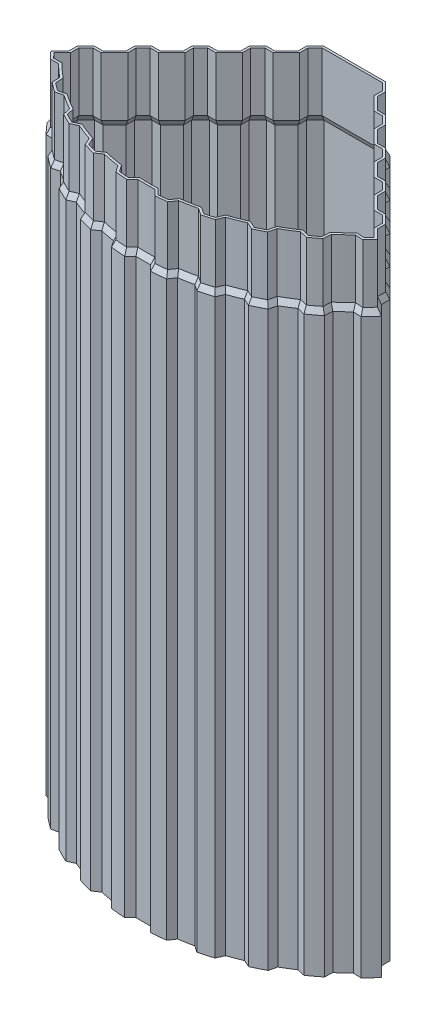
from build123d import *

# Parameters (mm, degrees)
EXTRUDE_THIN2_DEPTH = 195
EXTRUDE_THIN3_DEPTH = 20


# Read off the part's stored shape, not the designer's step: Extrude-Thin2
with BuildPart() as part:
    # Extrude-Thin2 outline → Extrude-Thin2 (new body)
    with BuildSketch(Plane(origin=(0, 0, 0), x_dir=(1, 0, 0), z_dir=(0, 1, 0))):
        with BuildLine():
            Line((11, 0), (-11, 0))
            Line((-11, 0), (-14.464746304, -3.464746304))
            Line((-14.464746304, -3.464746304), (-14.464746304, -6.293173428))
            Line((-14.464746304, -6.293173428), (-17.929492607, -9.757919732))
            Line((-17.929492607, -9.757919732), (-20.757919732, -9.757919732))
            Line((-20.757919732, -9.757919732), (-24.222666036, -13.222666036))
            Line((-24.222666036, -13.222666036), (-24.222666036, -16.05109316))
            Line((-24.222666036, -16.05109316), (-27.687412339, -19.515839464))
            Line((-27.687412339, -19.515839464), (-30.515839464, -19.515839464))
            Line((-30.515839464, -19.515839464), (-33.980585767, -22.980585767))
            Line((-33.980585767, -22.980585767), (-33.980585767, -25.809012892))
            Line((-33.980585767, -25.809012892), (-37.445332071, -29.273759196))
            Line((-37.445332071, -29.273759196), (-40.273759196, -29.273759196))
            Line((-40.273759196, -29.273759196), (-43.738505499, -32.738505499))
            Line((-43.738505499, -32.738505499), (-43.738505499, -35.566932624))
            Line((-43.738505499, -35.566932624), (-47.203251803, -39.031678928))
            Line((-47.203251803, -39.031678928), (-50.031678928, -39.031678928))
            Line((-50.031678928, -39.031678928), (-53.496425231, -42.496425231))
            Line((-53.496425231, -42.496425231), (-53.496425231, -45.324852356))
            Line((-53.496425231, -45.324852356), (-56.961171535, -48.78959866))
            ThreePointArc((-56.961171535, -48.78959866), (-55.321694232, -50.640992756), (-53.622070731, -52.437329552))
            Line((-53.622070731, -52.437329552), (-50.919920763, -52.308332697))
            ThreePointArc((-50.919920763, -52.308332697), (-49.098670593, -54.021482264), (-47.219819238, -55.67125534))
            Line((-47.219819238, -55.67125534), (-47.090822383, -58.373405308))
            ThreePointArc((-47.090822383, -58.373405308), (-45.118873367, -59.910660705), (-43.096778336, -61.381330199))
            Line((-43.096778336, -61.381330199), (-40.464106768, -60.758999855))
            ThreePointArc((-40.464106768, -60.758999855), (-38.359583424, -62.109116558), (-36.210057689, -63.386368583))
            Line((-36.210057689, -63.386368583), (-35.587727345, -66.019040151))
            ThreePointArc((-35.587727345, -66.019040151), (-33.367316218, -67.16861029), (-31.109819992, -68.243527899))
            Line((-31.109819992, -68.243527899), (-28.635916247, -67.148970958))
            ThreePointArc((-28.635916247, -67.148970958), (-26.319496526, -68.090264375), (-23.972199509, -68.951676199))
            Line((-23.972199509, -68.951676199), (-22.877642568, -71.425579945))
            ThreePointArc((-22.877642568, -71.425579945), (-20.48407657, -72.148476125), (-18.06774416, -72.79118505))
            Line((-18.06774416, -72.79118505), (-15.836512903, -71.261524395))
            ThreePointArc((-15.836512903, -71.261524395), (-13.386760262, -71.762069714), (-10.921302649, -72.178425783))
            Line((-10.921302649, -72.178425783), (-9.391641994, -74.409657039))
            ThreePointArc((-9.391641994, -74.409657039), (-6.906101064, -74.681361584), (-4.412884555, -74.870063777))
            Line((-4.412884555, -74.870063777), (-2.5, -72.957179222))
            ThreePointArc((-2.5, -72.957179222), (0, -73), (2.5, -72.957179222))
            Line((2.5, -72.957179222), (4.412884555, -74.870063777))
            ThreePointArc((4.412884555, -74.870063777), (6.906101064, -74.681361584), (9.391641994, -74.409657039))
            Line((9.391641994, -74.409657039), (10.921302649, -72.178425783))
            ThreePointArc((10.921302649, -72.178425783), (13.386760262, -71.762069714), (15.836512903, -71.261524395))
            Line((15.836512903, -71.261524395), (18.06774416, -72.79118505))
            ThreePointArc((18.06774416, -72.79118505), (20.48407657, -72.148476125), (22.877642568, -71.425579945))
            Line((22.877642568, -71.425579945), (23.972199509, -68.951676199))
            ThreePointArc((23.972199509, -68.951676199), (26.319496526, -68.090264375), (28.635916247, -67.148970958))
            Line((28.635916247, -67.148970958), (31.109819992, -68.243527899))
            ThreePointArc((31.109819992, -68.243527899), (33.367316218, -67.16861029), (35.587727345, -66.019040151))
            Line((35.587727345, -66.019040151), (36.210057689, -63.386368583))
            ThreePointArc((36.210057689, -63.386368583), (38.359583424, -62.109116558), (40.464106768, -60.758999855))
            Line((40.464106768, -60.758999855), (43.096778336, -61.381330199))
            ThreePointArc((43.096778336, -61.381330199), (45.118873367, -59.910660705), (47.090822383, -58.373405308))
            Line((47.090822383, -58.373405308), (47.219819238, -55.67125534))
            ThreePointArc((47.219819238, -55.67125534), (49.098670593, -54.021482264), (50.919920763, -52.308332697))
            Line((50.919920763, -52.308332697), (53.622070731, -52.437329552))
            ThreePointArc((53.622070731, -52.437329552), (55.321694232, -50.640992756), (56.961171535, -48.78959866))
            Line((56.961171535, -48.78959866), (53.496425231, -45.324852356))
            Line((53.496425231, -45.324852356), (53.496425231, -42.496425231))
            Line((53.496425231, -42.496425231), (50.031678928, -39.031678928))
            Line((50.031678928, -39.031678928), (47.203251803, -39.031678928))
            Line((47.203251803, -39.031678928), (43.738505499, -35.566932624))
            Line((43.738505499, -35.566932624), (43.738505499, -32.738505499))
            Line((43.738505499, -32.738505499), (40.273759196, -29.273759196))
            Line((40.273759196, -29.273759196), (37.445332071, -29.273759196))
            Line((37.445332071, -29.273759196), (33.980585767, -25.809012892))
            Line((33.980585767, -25.809012892), (33.980585767, -22.980585767))
            Line((33.980585767, -22.980585767), (30.515839464, -19.515839464))
            Line((30.515839464, -19.515839464), (27.687412339, -19.515839464))
            Line((27.687412339, -19.515839464), (24.222666036, -16.05109316))
            Line((24.222666036, -16.05109316), (24.222666036, -13.222666036))
            Line((24.222666036, -13.222666036), (20.757919732, -9.757919732))
            Line((20.757919732, -9.757919732), (17.929492607, -9.757919732))
            Line((17.929492607, -9.757919732), (14.464746304, -6.293173428))
            Line((14.464746304, -6.293173428), (14.464746304, -3.464746304))
            Line((14.464746304, -3.464746304), (11, 0))
        make_face()
        with BuildLine():
            Line((-13.664746304, -3.796117153), (-10.66862915, -0.8))
            Line((-10.66862915, -0.8), (10.66862915, -0.8))
            Line((10.66862915, -0.8), (13.664746304, -3.796117153))
            Line((13.664746304, -3.796117153), (13.664746304, -6.624544278))
            Line((13.664746304, -6.624544278), (17.598121757, -10.557919732))
            Line((17.598121757, -10.557919732), (20.426548882, -10.557919732))
            Line((20.426548882, -10.557919732), (23.422666036, -13.554036885))
            Line((23.422666036, -13.554036885), (23.422666036, -16.38246401))
            Line((23.422666036, -16.38246401), (27.356041489, -20.315839464))
            Line((27.356041489, -20.315839464), (30.184468614, -20.315839464))
            Line((30.184468614, -20.315839464), (33.180585767, -23.311956617))
            Line((33.180585767, -23.311956617), (33.180585767, -26.140383742))
            Line((33.180585767, -26.140383742), (37.113961221, -30.073759196))
            Line((37.113961221, -30.073759196), (39.942388346, -30.073759196))
            Line((39.942388346, -30.073759196), (42.938505499, -33.069876349))
            Line((42.938505499, -33.069876349), (42.938505499, -35.898303474))
            Line((42.938505499, -35.898303474), (46.871880953, -39.831678928))
            Line((46.871880953, -39.831678928), (49.700308078, -39.831678928))
            Line((49.700308078, -39.831678928), (52.696425231, -42.827796081))
            Line((52.696425231, -42.827796081), (52.696425231, -45.656223206))
            Line((52.696425231, -45.656223206), (55.869206916, -48.82900489))
            ThreePointArc((55.869206916, -48.82900489), (54.602532645, -50.2414513), (53.300160418, -51.621050933))
            Line((53.300160418, -51.621050933), (50.609786331, -51.492616242))
            ThreePointArc((50.609786331, -51.492616242), (48.56060297, -53.42946602), (46.437355761, -55.284826037))
            Line((46.437355761, -55.284826037), (46.30892107, -57.975200123))
            ThreePointArc((46.30892107, -57.975200123), (44.637605384, -59.271613657), (42.930016361, -60.51986199))
            Line((42.930016361, -60.51986199), (40.308817891, -59.900243741))
            ThreePointArc((40.308817891, -59.900243741), (37.939204427, -61.428468705), (35.511726701, -62.863003959))
            Line((35.511726701, -62.863003959), (34.892108452, -65.484202429))
            ThreePointArc((34.892108452, -65.484202429), (33.011398179, -66.452145114), (31.103862238, -67.366087566))
            Line((31.103862238, -67.366087566), (28.640739684, -66.276300669))
            ThreePointArc((28.640739684, -66.276300669), (26.031063687, -67.344069697), (23.381685532, -68.309126635))
            Line((23.381685532, -68.309126635), (22.291898635, -70.772249189))
            ThreePointArc((22.291898635, -70.772249189), (20.265579753, -71.378892379), (18.222792688, -71.927531771))
            Line((18.222792688, -71.927531771), (16.001285065, -70.404537327))
            ThreePointArc((16.001285065, -70.404537327), (13.24005604, -70.975636074), (10.458633495, -71.438483924))
            Line((10.458633495, -71.438483924), (8.935639052, -73.659991547))
            ThreePointArc((8.935639052, -73.659991547), (6.832435985, -73.884760394), (4.723680756, -74.049489128))
            Line((4.723680756, -74.049489128), (2.81913249, -72.144940862))
            ThreePointArc((2.81913249, -72.144940862), (0, -72.2), (-2.81913249, -72.144940862))
            Line((-2.81913249, -72.144940862), (-4.723680756, -74.049489128))
            ThreePointArc((-4.723680756, -74.049489128), (-6.832435985, -73.884760394), (-8.935639052, -73.659991547))
            Line((-8.935639052, -73.659991547), (-10.458633495, -71.438483924))
            ThreePointArc((-10.458633495, -71.438483924), (-13.24005604, -70.975636074), (-16.001285065, -70.404537327))
            Line((-16.001285065, -70.404537327), (-18.222792688, -71.927531771))
            ThreePointArc((-18.222792688, -71.927531771), (-20.265579753, -71.378892379), (-22.291898635, -70.772249189))
            Line((-22.291898635, -70.772249189), (-23.381685532, -68.309126635))
            ThreePointArc((-23.381685532, -68.309126635), (-26.031063687, -67.344069697), (-28.640739684, -66.276300669))
            Line((-28.640739684, -66.276300669), (-31.103862238, -67.366087566))
            ThreePointArc((-31.103862238, -67.366087566), (-33.011398179, -66.452145114), (-34.892108452, -65.484202429))
            Line((-34.892108452, -65.484202429), (-35.511726701, -62.863003959))
            ThreePointArc((-35.511726701, -62.863003959), (-37.939204427, -61.428468705), (-40.308817891, -59.900243741))
            Line((-40.308817891, -59.900243741), (-42.930016361, -60.51986199))
            ThreePointArc((-42.930016361, -60.51986199), (-44.637605384, -59.271613657), (-46.30892107, -57.975200123))
            Line((-46.30892107, -57.975200123), (-46.437355761, -55.284826037))
            ThreePointArc((-46.437355761, -55.284826037), (-48.56060297, -53.42946602), (-50.609786331, -51.492616242))
            Line((-50.609786331, -51.492616242), (-53.300160418, -51.621050933))
            ThreePointArc((-53.300160418, -51.621050933), (-54.602532645, -50.2414513), (-55.869206916, -48.82900489))
            Line((-55.869206916, -48.82900489), (-52.696425231, -45.656223206))
            Line((-52.696425231, -45.656223206), (-52.696425231, -42.827796081))
            Line((-52.696425231, -42.827796081), (-49.700308078, -39.831678928))
            Line((-49.700308078, -39.831678928), (-46.871880953, -39.831678928))
            Line((-46.871880953, -39.831678928), (-42.938505499, -35.898303474))
            Line((-42.938505499, -35.898303474), (-42.938505499, -33.069876349))
            Line((-42.938505499, -33.069876349), (-39.942388346, -30.073759196))
            Line((-39.942388346, -30.073759196), (-37.113961221, -30.073759196))
            Line((-37.113961221, -30.073759196), (-33.180585767, -26.140383742))
            Line((-33.180585767, -26.140383742), (-33.180585767, -23.311956617))
            Line((-33.180585767, -23.311956617), (-30.184468614, -20.315839464))
            Line((-30.184468614, -20.315839464), (-27.356041489, -20.315839464))
            Line((-27.356041489, -20.315839464), (-23.422666036, -16.38246401))
            Line((-23.422666036, -16.38246401), (-23.422666036, -13.554036885))
            Line((-23.422666036, -13.554036885), (-20.426548882, -10.557919732))
            Line((-20.426548882, -10.557919732), (-17.598121757, -10.557919732))
            Line((-17.598121757, -10.557919732), (-13.664746304, -6.624544278))
            Line((-13.664746304, -6.624544278), (-13.664746304, -3.796117153))
        make_face(mode=Mode.SUBTRACT)
    extrude(amount=EXTRUDE_THIN2_DEPTH)



with BuildPart() as body_2:
    # Sketch7 → Extrude-Thin3 (new body)
    with BuildSketch(Plane(origin=(0, 197, 0), x_dir=(1, 0, 0), z_dir=(0, 1, 0))):
        with BuildLine():
            Line((55.595386981, -48.838027668), (52.496425231, -45.739065918))
            Line((52.496425231, -45.739065918), (52.496425231, -42.910638794))
            Line((52.496425231, -42.910638794), (49.617465365, -40.031678928))
            Line((49.617465365, -40.031678928), (46.789038241, -40.031678928))
            Line((46.789038241, -40.031678928), (42.738505499, -35.981146187))
            Line((42.738505499, -35.981146187), (42.738505499, -33.152719062))
            Line((42.738505499, -33.152719062), (39.859545633, -30.273759196))
            Line((39.859545633, -30.273759196), (37.031118509, -30.273759196))
            Line((37.031118509, -30.273759196), (32.980585767, -26.223226455))
            Line((32.980585767, -26.223226455), (32.980585767, -23.39479933))
            Line((32.980585767, -23.39479933), (30.101625901, -20.515839464))
            Line((30.101625901, -20.515839464), (27.273198777, -20.515839464))
            Line((27.273198777, -20.515839464), (23.222666036, -16.465306723))
            Line((23.222666036, -16.465306723), (23.222666036, -13.636879598))
            Line((23.222666036, -13.636879598), (20.34370617, -10.757919732))
            Line((20.34370617, -10.757919732), (17.515279045, -10.757919732))
            Line((17.515279045, -10.757919732), (13.464746304, -6.707386991))
            Line((13.464746304, -6.707386991), (13.464746304, -3.878959866))
            Line((13.464746304, -3.878959866), (10.585786438, -1))
            Line((10.585786438, -1), (-10.585786438, -1))
            Line((-10.585786438, -1), (-13.464746304, -3.878959866))
            Line((-13.464746304, -3.878959866), (-13.464746304, -6.707386991))
            Line((-13.464746304, -6.707386991), (-17.515279045, -10.757919732))
            Line((-17.515279045, -10.757919732), (-20.34370617, -10.757919732))
            Line((-20.34370617, -10.757919732), (-23.222666036, -13.636879598))
            Line((-23.222666036, -13.636879598), (-23.222666036, -16.465306723))
            Line((-23.222666036, -16.465306723), (-27.273198777, -20.515839464))
            Line((-27.273198777, -20.515839464), (-30.101625901, -20.515839464))
            Line((-30.101625901, -20.515839464), (-32.980585767, -23.39479933))
            Line((-32.980585767, -23.39479933), (-32.980585767, -26.223226455))
            Line((-32.980585767, -26.223226455), (-37.031118509, -30.273759196))
            Line((-37.031118509, -30.273759196), (-39.859545633, -30.273759196))
            Line((-39.859545633, -30.273759196), (-42.738505499, -33.152719062))
            Line((-42.738505499, -33.152719062), (-42.738505499, -35.981146187))
            Line((-42.738505499, -35.981146187), (-46.789038241, -40.031678928))
            Line((-46.789038241, -40.031678928), (-49.617465365, -40.031678928))
            Line((-49.617465365, -40.031678928), (-52.496425231, -42.910638794))
            Line((-52.496425231, -42.910638794), (-52.496425231, -45.739065918))
            Line((-52.496425231, -45.739065918), (-55.595386981, -48.838027668))
            ThreePointArc((-55.595386981, -48.838027668), (-54.422630791, -50.141572151), (-53.219318169, -51.41696387))
            Line((-53.219318169, -51.41696387), (-50.53189417, -51.288670012))
            ThreePointArc((-50.53189417, -51.288670012), (-48.426086065, -53.281461959), (-46.241757009, -55.187860158))
            Line((-46.241757009, -55.187860158), (-46.113463151, -57.875284157))
            ThreePointArc((-46.113463151, -57.875284157), (-44.517288389, -59.111851895), (-42.887970574, -60.30441095))
            Line((-42.887970574, -60.30441095), (-40.269646337, -59.685472134))
            ThreePointArc((-40.269646337, -59.685472134), (-37.834109678, -61.258306742), (-35.337226532, -62.731813468))
            Line((-35.337226532, -62.731813468), (-34.718287716, -65.350137705))
            ThreePointArc((-34.718287716, -65.350137705), (-32.922418669, -66.27302882), (-31.102038932, -67.146579766))
            Line((-31.102038932, -67.146579766), (-28.641617276, -66.057987858))
            ThreePointArc((-28.641617276, -66.057987858), (-25.958955478, -67.157521027), (-23.234202276, -68.148160977))
            Line((-23.234202276, -68.148160977), (-22.145610368, -70.608582633))
            ThreePointArc((-22.145610368, -70.608582633), (-20.210955548, -71.186496443), (-18.261253703, -71.711412015))
            Line((-18.261253703, -71.711412015), (-16.042182039, -70.190087587))
            ThreePointArc((-16.042182039, -70.190087587), (-13.203379985, -70.779027663), (-10.343169181, -71.253202393))
            Line((-10.343169181, -71.253202393), (-8.821844752, -73.472274057))
            ThreePointArc((-8.821844752, -73.472274057), (-6.814019716, -73.685610097), (-4.801121652, -73.844087312))
            Line((-4.801121652, -73.844087312), (-2.898661788, -71.941627448))
            ThreePointArc((-2.898661788, -71.941627448), (0, -72), (2.898661788, -71.941627448))
            Line((2.898661788, -71.941627448), (4.801121652, -73.844087312))
            ThreePointArc((4.801121652, -73.844087312), (6.814019716, -73.685610097), (8.821844752, -73.472274057))
            Line((8.821844752, -73.472274057), (10.343169181, -71.253202393))
            ThreePointArc((10.343169181, -71.253202393), (13.203379985, -70.779027663), (16.042182039, -70.190087587))
            Line((16.042182039, -70.190087587), (18.261253703, -71.711412015))
            ThreePointArc((18.261253703, -71.711412015), (20.210955548, -71.186496443), (22.145610368, -70.608582633))
            Line((22.145610368, -70.608582633), (23.234202276, -68.148160977))
            ThreePointArc((23.234202276, -68.148160977), (25.958955478, -67.157521027), (28.641617276, -66.057987858))
            Line((28.641617276, -66.057987858), (31.102038932, -67.146579766))
            ThreePointArc((31.102038932, -67.146579766), (32.922418669, -66.27302882), (34.718287716, -65.350137705))
            Line((34.718287716, -65.350137705), (35.337226532, -62.731813468))
            ThreePointArc((35.337226532, -62.731813468), (37.834109678, -61.258306742), (40.269646337, -59.685472134))
            Line((40.269646337, -59.685472134), (42.887970574, -60.30441095))
            ThreePointArc((42.887970574, -60.30441095), (44.517288389, -59.111851895), (46.113463151, -57.875284157))
            Line((46.113463151, -57.875284157), (46.241757009, -55.187860158))
            ThreePointArc((46.241757009, -55.187860158), (48.426086065, -53.281461959), (50.53189417, -51.288670012))
            Line((50.53189417, -51.288670012), (53.219318169, -51.41696387))
            ThreePointArc((53.219318169, -51.41696387), (54.422630791, -50.141572151), (55.595386981, -48.838027668))
        make_face()
        with BuildLine():
            Line((54.496715687, -48.870727224), (51.696425231, -46.070436768))
            Line((51.696425231, -46.070436768), (51.696425231, -43.242009644))
            Line((51.696425231, -43.242009644), (49.286094515, -40.831678928))
            Line((49.286094515, -40.831678928), (46.457667391, -40.831678928))
            Line((46.457667391, -40.831678928), (41.938505499, -36.312517036))
            Line((41.938505499, -36.312517036), (41.938505499, -33.484089912))
            Line((41.938505499, -33.484089912), (39.528174784, -31.073759196))
            Line((39.528174784, -31.073759196), (36.699747659, -31.073759196))
            Line((36.699747659, -31.073759196), (32.180585767, -26.554597304))
            Line((32.180585767, -26.554597304), (32.180585767, -23.72617018))
            Line((32.180585767, -23.72617018), (29.770255052, -21.315839464))
            Line((29.770255052, -21.315839464), (26.941827927, -21.315839464))
            Line((26.941827927, -21.315839464), (22.422666036, -16.796677573))
            Line((22.422666036, -16.796677573), (22.422666036, -13.968250448))
            Line((22.422666036, -13.968250448), (20.01233532, -11.557919732))
            Line((20.01233532, -11.557919732), (17.183908195, -11.557919732))
            Line((17.183908195, -11.557919732), (12.664746304, -7.038757841))
            Line((12.664746304, -7.038757841), (12.664746304, -4.210330716))
            Line((12.664746304, -4.210330716), (10.254415588, -1.8))
            Line((10.254415588, -1.8), (-10.254415588, -1.8))
            Line((-10.254415588, -1.8), (-12.664746304, -4.210330716))
            Line((-12.664746304, -4.210330716), (-12.664746304, -7.038757841))
            Line((-12.664746304, -7.038757841), (-17.183908195, -11.557919732))
            Line((-17.183908195, -11.557919732), (-20.01233532, -11.557919732))
            Line((-20.01233532, -11.557919732), (-22.422666036, -13.968250448))
            Line((-22.422666036, -13.968250448), (-22.422666036, -16.796677573))
            Line((-22.422666036, -16.796677573), (-26.941827927, -21.315839464))
            Line((-26.941827927, -21.315839464), (-29.770255052, -21.315839464))
            Line((-29.770255052, -21.315839464), (-32.180585767, -23.72617018))
            Line((-32.180585767, -23.72617018), (-32.180585767, -26.554597304))
            Line((-32.180585767, -26.554597304), (-36.699747659, -31.073759196))
            Line((-36.699747659, -31.073759196), (-39.528174784, -31.073759196))
            Line((-39.528174784, -31.073759196), (-41.938505499, -33.484089912))
            Line((-41.938505499, -33.484089912), (-41.938505499, -36.312517036))
            Line((-41.938505499, -36.312517036), (-46.457667391, -40.831678928))
            Line((-46.457667391, -40.831678928), (-49.286094515, -40.831678928))
            Line((-49.286094515, -40.831678928), (-51.696425231, -43.242009644))
            Line((-51.696425231, -43.242009644), (-51.696425231, -46.070436768))
            Line((-51.696425231, -46.070436768), (-54.496715687, -48.870727224))
            ThreePointArc((-54.496715687, -48.870727224), (-53.702557706, -49.742087771), (-52.894468995, -50.600544955))
            Line((-52.894468995, -50.600544955), (-50.218869817, -50.472815597))
            ThreePointArc((-50.218869817, -50.472815597), (-47.888018442, -52.689445715), (-45.459431492, -54.798540933))
            Line((-45.459431492, -54.798540933), (-45.331702135, -57.474140112))
            ThreePointArc((-45.331702135, -57.474140112), (-44.036020406, -58.472804848), (-42.718345303, -59.442265894))
            Line((-42.718345303, -59.442265894), (-40.111541844, -58.826050444))
            ThreePointArc((-40.111541844, -58.826050444), (-37.413730682, -60.577658889), (-34.639561119, -62.205633229))
            Line((-34.639561119, -62.205633229), (-34.02334567, -64.812436688))
            ThreePointArc((-34.02334567, -64.812436688), (-32.56650063, -65.556563643), (-31.093390558, -66.267948992))
            Line((-31.093390558, -66.267948992), (-28.6437949, -65.184146951))
            ThreePointArc((-28.6437949, -65.184146951), (-25.670522639, -66.411326349), (-22.644858917, -67.502965599))
            Line((-22.644858917, -67.502965599), (-21.561056876, -69.952561257))
            ThreePointArc((-21.561056876, -69.952561257), (-19.992458732, -70.416912698), (-18.413875543, -70.846095076))
            Line((-18.413875543, -70.846095076), (-16.204567922, -69.331464563))
            ThreePointArc((-16.204567922, -69.331464563), (-13.056675763, -69.992594023), (-9.882135983, -70.510874256))
            Line((-9.882135983, -70.510874256), (-8.36750547, -72.720181877))
            ThreePointArc((-8.36750547, -72.720181877), (-6.740354638, -72.889008906), (-5.109837399, -73.021432208))
            Line((-5.109837399, -73.021432208), (-3.215748468, -71.127343278))
            ThreePointArc((-3.215748468, -71.127343278), (0, -71.2), (3.215748468, -71.127343278))
            Line((3.215748468, -71.127343278), (5.109837399, -73.021432208))
            ThreePointArc((5.109837399, -73.021432208), (6.740354638, -72.889008906), (8.36750547, -72.720181877))
            Line((8.36750547, -72.720181877), (9.882135983, -70.510874256))
            ThreePointArc((9.882135983, -70.510874256), (13.056675763, -69.992594023), (16.204567922, -69.331464563))
            Line((16.204567922, -69.331464563), (18.413875543, -70.846095076))
            ThreePointArc((18.413875543, -70.846095076), (19.992458732, -70.416912698), (21.561056876, -69.952561257))
            Line((21.561056876, -69.952561257), (22.644858917, -67.502965599))
            ThreePointArc((22.644858917, -67.502965599), (25.670522639, -66.411326349), (28.6437949, -65.184146951))
            Line((28.6437949, -65.184146951), (31.093390558, -66.267948992))
            ThreePointArc((31.093390558, -66.267948992), (32.56650063, -65.556563643), (34.02334567, -64.812436688))
            Line((34.02334567, -64.812436688), (34.639561119, -62.205633229))
            ThreePointArc((34.639561119, -62.205633229), (37.413730682, -60.577658889), (40.111541844, -58.826050444))
            Line((40.111541844, -58.826050444), (42.718345303, -59.442265894))
            ThreePointArc((42.718345303, -59.442265894), (44.036020406, -58.472804848), (45.331702135, -57.474140112))
            Line((45.331702135, -57.474140112), (45.459431492, -54.798540933))
            ThreePointArc((45.459431492, -54.798540933), (47.888018442, -52.689445715), (50.218869817, -50.472815597))
            Line((50.218869817, -50.472815597), (52.894468995, -50.600544955))
            ThreePointArc((52.894468995, -50.600544955), (53.702557706, -49.742087771), (54.496715687, -48.870727224))
        make_face(mode=Mode.SUBTRACT)
    extrude(amount=EXTRUDE_THIN3_DEPTH)


with BuildPart() as part_1:
    add(part.part)

    add(body_2.part)  # Loft1 merges body 2
    # Sketch9 → Loft1 section 0
    with BuildSketch(Plane(origin=(0, 195, 0), x_dir=(1, 0, 0), z_dir=(0, 1, 0))):
        with BuildLine():
            Line((14.464746304, -3.464746304), (11, 0))
            Line((11, 0), (-11, 0))
            Line((-11, 0), (-14.464746304, -3.464746304))
            Line((-14.464746304, -3.464746304), (-14.464746304, -6.293173428))
            Line((-14.464746304, -6.293173428), (-17.929492607, -9.757919732))
            Line((-17.929492607, -9.757919732), (-20.757919732, -9.757919732))
            Line((-20.757919732, -9.757919732), (-24.222666036, -13.222666036))
            Line((-24.222666036, -13.222666036), (-24.222666036, -16.05109316))
            Line((-24.222666036, -16.05109316), (-27.687412339, -19.515839464))
            Line((-27.687412339, -19.515839464), (-30.515839464, -19.515839464))
            Line((-30.515839464, -19.515839464), (-33.980585767, -22.980585767))
            Line((-33.980585767, -22.980585767), (-33.980585767, -25.809012892))
            Line((-33.980585767, -25.809012892), (-37.445332071, -29.273759196))
            Line((-37.445332071, -29.273759196), (-40.273759196, -29.273759196))
            Line((-40.273759196, -29.273759196), (-43.738505499, -32.738505499))
            Line((-43.738505499, -32.738505499), (-43.738505499, -35.566932624))
            Line((-43.738505499, -35.566932624), (-47.203251803, -39.031678928))
            Line((-47.203251803, -39.031678928), (-50.031678928, -39.031678928))
            Line((-50.031678928, -39.031678928), (-53.496425231, -42.496425231))
            Line((-53.496425231, -42.496425231), (-53.496425231, -45.324852356))
            Line((-53.496425231, -45.324852356), (-56.961171535, -48.78959866))
            ThreePointArc((-56.961171535, -48.78959866), (-55.321694232, -50.640992756), (-53.622070731, -52.437329552))
            Line((-53.622070731, -52.437329552), (-50.919920763, -52.308332697))
            ThreePointArc((-50.919920763, -52.308332697), (-49.098670593, -54.021482264), (-47.219819238, -55.67125534))
            Line((-47.219819238, -55.67125534), (-47.090822383, -58.373405308))
            ThreePointArc((-47.090822383, -58.373405308), (-45.118873367, -59.910660705), (-43.096778336, -61.381330199))
            Line((-43.096778336, -61.381330199), (-40.464106768, -60.758999855))
            ThreePointArc((-40.464106768, -60.758999855), (-38.359583424, -62.109116558), (-36.210057689, -63.386368583))
            Line((-36.210057689, -63.386368583), (-35.587727345, -66.019040151))
            ThreePointArc((-35.587727345, -66.019040151), (-33.367316219, -67.16861029), (-31.109819992, -68.243527899))
            Line((-31.109819992, -68.243527899), (-28.635916247, -67.148970958))
            ThreePointArc((-28.635916247, -67.148970958), (-26.319496526, -68.090264375), (-23.972199509, -68.951676199))
            Line((-23.972199509, -68.951676199), (-22.877642568, -71.425579945))
            ThreePointArc((-22.877642568, -71.425579945), (-20.484076569, -72.148476125), (-18.06774416, -72.79118505))
            Line((-18.06774416, -72.79118505), (-15.836512903, -71.261524395))
            ThreePointArc((-15.836512903, -71.261524395), (-13.386760262, -71.762069714), (-10.921302649, -72.178425783))
            Line((-10.921302649, -72.178425783), (-9.391641994, -74.409657039))
            ThreePointArc((-9.391641994, -74.409657039), (-6.906101063, -74.681361584), (-4.412884555, -74.870063777))
            Line((-4.412884555, -74.870063777), (-2.5, -72.957179222))
            ThreePointArc((-2.5, -72.957179222), (0, -73), (2.5, -72.957179222))
            Line((2.5, -72.957179222), (4.412884555, -74.870063777))
            ThreePointArc((4.412884555, -74.870063777), (6.906101063, -74.681361584), (9.391641994, -74.409657039))
            Line((9.391641994, -74.409657039), (10.921302649, -72.178425783))
            ThreePointArc((10.921302649, -72.178425783), (13.386760262, -71.762069714), (15.836512903, -71.261524395))
            Line((15.836512903, -71.261524395), (18.06774416, -72.79118505))
            ThreePointArc((18.06774416, -72.79118505), (20.484076569, -72.148476125), (22.877642568, -71.425579945))
            Line((22.877642568, -71.425579945), (23.972199509, -68.951676199))
            ThreePointArc((23.972199509, -68.951676199), (26.319496526, -68.090264375), (28.635916247, -67.148970958))
            Line((28.635916247, -67.148970958), (31.109819992, -68.243527899))
            ThreePointArc((31.109819992, -68.243527899), (33.367316219, -67.16861029), (35.587727345, -66.019040151))
            Line((35.587727345, -66.019040151), (36.210057689, -63.386368583))
            ThreePointArc((36.210057689, -63.386368583), (38.359583424, -62.109116558), (40.464106768, -60.758999855))
            Line((40.464106768, -60.758999855), (43.096778336, -61.381330199))
            ThreePointArc((43.096778336, -61.381330199), (45.118873367, -59.910660705), (47.090822383, -58.373405308))
            Line((47.090822383, -58.373405308), (47.219819238, -55.67125534))
            ThreePointArc((47.219819238, -55.67125534), (49.098670593, -54.021482264), (50.919920763, -52.308332697))
            Line((50.919920763, -52.308332697), (53.622070731, -52.437329552))
            ThreePointArc((53.622070731, -52.437329552), (55.321694232, -50.640992756), (56.961171535, -48.78959866))
            Line((56.961171535, -48.78959866), (53.496425231, -45.324852356))
            Line((53.496425231, -45.324852356), (53.496425231, -42.496425231))
            Line((53.496425231, -42.496425231), (50.031678928, -39.031678928))
            Line((50.031678928, -39.031678928), (47.203251803, -39.031678928))
            Line((47.203251803, -39.031678928), (43.738505499, -35.566932624))
            Line((43.738505499, -35.566932624), (43.738505499, -32.738505499))
            Line((43.738505499, -32.738505499), (40.273759196, -29.273759196))
            Line((40.273759196, -29.273759196), (37.445332071, -29.273759196))
            Line((37.445332071, -29.273759196), (33.980585767, -25.809012892))
            Line((33.980585767, -25.809012892), (33.980585767, -22.980585767))
            Line((33.980585767, -22.980585767), (30.515839464, -19.515839464))
            Line((30.515839464, -19.515839464), (27.687412339, -19.515839464))
            Line((27.687412339, -19.515839464), (24.222666036, -16.05109316))
            Line((24.222666036, -16.05109316), (24.222666036, -13.222666036))
            Line((24.222666036, -13.222666036), (20.757919732, -9.757919732))
            Line((20.757919732, -9.757919732), (17.929492607, -9.757919732))
            Line((17.929492607, -9.757919732), (14.464746304, -6.293173428))
            Line((14.464746304, -6.293173428), (14.464746304, -3.464746304))
        make_face()
    # Sketch8 → Loft1 section 1
    with BuildSketch(Plane.XZ.offset(-197)):
        with BuildLine():
            Line((13.464746304, 3.878959866), (13.464746304, 6.707386991))
            Line((13.464746304, 6.707386991), (17.515279045, 10.757919732))
            Line((17.515279045, 10.757919732), (20.34370617, 10.757919732))
            Line((20.34370617, 10.757919732), (23.222666036, 13.636879598))
            Line((23.222666036, 13.636879598), (23.222666036, 16.465306723))
            Line((23.222666036, 16.465306723), (27.273198777, 20.515839464))
            Line((27.273198777, 20.515839464), (30.101625901, 20.515839464))
            Line((30.101625901, 20.515839464), (32.980585767, 23.39479933))
            Line((32.980585767, 23.39479933), (32.980585767, 26.223226455))
            Line((32.980585767, 26.223226455), (37.031118509, 30.273759196))
            Line((37.031118509, 30.273759196), (39.859545633, 30.273759196))
            Line((39.859545633, 30.273759196), (42.738505499, 33.152719062))
            Line((42.738505499, 33.152719062), (42.738505499, 35.981146187))
            Line((42.738505499, 35.981146187), (46.789038241, 40.031678928))
            Line((46.789038241, 40.031678928), (49.617465365, 40.031678928))
            Line((49.617465365, 40.031678928), (52.496425231, 42.910638794))
            Line((52.496425231, 42.910638794), (52.496425231, 45.739065918))
            Line((52.496425231, 45.739065918), (55.595386981, 48.838027668))
            ThreePointArc((55.595386981, 48.838027668), (54.422630791, 50.141572151), (53.219318169, 51.41696387))
            Line((53.219318169, 51.41696387), (50.53189417, 51.288670012))
            ThreePointArc((50.53189417, 51.288670012), (48.426086065, 53.281461959), (46.241757009, 55.187860158))
            Line((46.241757009, 55.187860158), (46.113463151, 57.875284157))
            ThreePointArc((46.113463151, 57.875284157), (44.517288389, 59.111851895), (42.887970574, 60.30441095))
            Line((42.887970574, 60.30441095), (40.269646337, 59.685472134))
            ThreePointArc((40.269646337, 59.685472134), (37.834109678, 61.258306742), (35.337226532, 62.731813468))
            Line((35.337226532, 62.731813468), (34.718287716, 65.350137705))
            ThreePointArc((34.718287716, 65.350137705), (32.922418669, 66.27302882), (31.102038932, 67.146579766))
            Line((31.102038932, 67.146579766), (28.641617276, 66.057987858))
            ThreePointArc((28.641617276, 66.057987858), (25.958955478, 67.157521027), (23.234202276, 68.148160977))
            Line((23.234202276, 68.148160977), (22.145610368, 70.608582633))
            ThreePointArc((22.145610368, 70.608582633), (20.210955548, 71.186496443), (18.261253703, 71.711412015))
            Line((18.261253703, 71.711412015), (16.042182039, 70.190087587))
            ThreePointArc((16.042182039, 70.190087587), (13.203379985, 70.779027663), (10.343169181, 71.253202393))
            Line((10.343169181, 71.253202393), (8.821844752, 73.472274057))
            ThreePointArc((8.821844752, 73.472274057), (6.814019716, 73.685610097), (4.801121652, 73.844087312))
            Line((4.801121652, 73.844087312), (2.898661788, 71.941627448))
            ThreePointArc((2.898661788, 71.941627448), (0, 72), (-2.898661788, 71.941627448))
            Line((-2.898661788, 71.941627448), (-4.801121652, 73.844087312))
            ThreePointArc((-4.801121652, 73.844087312), (-6.814019716, 73.685610097), (-8.821844752, 73.472274057))
            Line((-8.821844752, 73.472274057), (-10.343169181, 71.253202393))
            ThreePointArc((-10.343169181, 71.253202393), (-13.203379985, 70.779027663), (-16.042182039, 70.190087587))
            Line((-16.042182039, 70.190087587), (-18.261253703, 71.711412015))
            ThreePointArc((-18.261253703, 71.711412015), (-20.210955548, 71.186496443), (-22.145610368, 70.608582633))
            Line((-22.145610368, 70.608582633), (-23.234202276, 68.148160977))
            ThreePointArc((-23.234202276, 68.148160977), (-25.958955478, 67.157521027), (-28.641617276, 66.057987858))
            Line((-28.641617276, 66.057987858), (-31.102038932, 67.146579766))
            ThreePointArc((-31.102038932, 67.146579766), (-32.922418669, 66.27302882), (-34.718287716, 65.350137705))
            Line((-34.718287716, 65.350137705), (-35.337226532, 62.731813468))
            ThreePointArc((-35.337226532, 62.731813468), (-37.834109678, 61.258306742), (-40.269646337, 59.685472134))
            Line((-40.269646337, 59.685472134), (-42.887970574, 60.30441095))
            ThreePointArc((-42.887970574, 60.30441095), (-44.517288389, 59.111851895), (-46.113463151, 57.875284157))
            Line((-46.113463151, 57.875284157), (-46.241757009, 55.187860158))
            ThreePointArc((-46.241757009, 55.187860158), (-48.426086065, 53.281461959), (-50.53189417, 51.288670012))
            Line((-50.53189417, 51.288670012), (-53.219318169, 51.41696387))
            ThreePointArc((-53.219318169, 51.41696387), (-54.422630791, 50.141572151), (-55.595386981, 48.838027668))
            Line((-55.595386981, 48.838027668), (-52.496425231, 45.739065918))
            Line((-52.496425231, 45.739065918), (-52.496425231, 42.910638794))
            Line((-52.496425231, 42.910638794), (-49.617465365, 40.031678928))
            Line((-49.617465365, 40.031678928), (-46.789038241, 40.031678928))
            Line((-46.789038241, 40.031678928), (-42.738505499, 35.981146187))
            Line((-42.738505499, 35.981146187), (-42.738505499, 33.152719062))
            Line((-42.738505499, 33.152719062), (-39.859545633, 30.273759196))
            Line((-39.859545633, 30.273759196), (-37.031118509, 30.273759196))
            Line((-37.031118509, 30.273759196), (-32.980585767, 26.223226455))
            Line((-32.980585767, 26.223226455), (-32.980585767, 23.39479933))
            Line((-32.980585767, 23.39479933), (-30.101625901, 20.515839464))
            Line((-30.101625901, 20.515839464), (-27.273198777, 20.515839464))
            Line((-27.273198777, 20.515839464), (-23.222666036, 16.465306723))
            Line((-23.222666036, 16.465306723), (-23.222666036, 13.636879598))
            Line((-23.222666036, 13.636879598), (-20.34370617, 10.757919732))
            Line((-20.34370617, 10.757919732), (-17.515279045, 10.757919732))
            Line((-17.515279045, 10.757919732), (-13.464746304, 6.707386991))
            Line((-13.464746304, 6.707386991), (-13.464746304, 3.878959866))
            Line((-13.464746304, 3.878959866), (-10.585786438, 1))
            Line((-10.585786438, 1), (10.585786438, 1))
            Line((10.585786438, 1), (13.464746304, 3.878959866))
        make_face()
    loft()

    # Sketch9<3> → Cut-Loft2 section 0
    with BuildSketch(Plane(origin=(0, 195, 0), x_dir=(1, 0, 0), z_dir=(0, 1, 0))):
        with BuildLine():
            Line((-53.300160418, -51.621050933), (-50.609786331, -51.492616242))
            ThreePointArc((-50.609786331, -51.492616242), (-48.56060297, -53.42946602), (-46.437355761, -55.284826037))
            Line((-46.437355761, -55.284826037), (-46.30892107, -57.975200123))
            ThreePointArc((-46.30892107, -57.975200123), (-44.637605384, -59.271613657), (-42.930016361, -60.51986199))
            Line((-42.930016361, -60.51986199), (-40.308817891, -59.900243741))
            ThreePointArc((-40.308817891, -59.900243741), (-37.939204427, -61.428468705), (-35.511726701, -62.863003959))
            Line((-35.511726701, -62.863003959), (-34.892108452, -65.484202429))
            ThreePointArc((-34.892108452, -65.484202429), (-33.011398179, -66.452145114), (-31.103862238, -67.366087566))
            Line((-31.103862238, -67.366087566), (-28.640739684, -66.276300669))
            ThreePointArc((-28.640739684, -66.276300669), (-26.031063687, -67.344069697), (-23.381685532, -68.309126635))
            Line((-23.381685532, -68.309126635), (-22.291898635, -70.772249189))
            ThreePointArc((-22.291898635, -70.772249189), (-20.265579753, -71.378892379), (-18.222792688, -71.927531771))
            Line((-18.222792688, -71.927531771), (-16.001285065, -70.404537327))
            ThreePointArc((-16.001285065, -70.404537327), (-13.24005604, -70.975636074), (-10.458633495, -71.438483924))
            Line((-10.458633495, -71.438483924), (-8.935639052, -73.659991547))
            ThreePointArc((-8.935639052, -73.659991547), (-6.832435985, -73.884760394), (-4.723680756, -74.049489128))
            Line((-4.723680756, -74.049489128), (-2.81913249, -72.144940862))
            ThreePointArc((-2.81913249, -72.144940862), (0, -72.2), (2.81913249, -72.144940862))
            Line((2.81913249, -72.144940862), (4.723680756, -74.049489128))
            ThreePointArc((4.723680756, -74.049489128), (6.832435985, -73.884760394), (8.935639052, -73.659991547))
            Line((8.935639052, -73.659991547), (10.458633495, -71.438483924))
            ThreePointArc((10.458633495, -71.438483924), (13.24005604, -70.975636074), (16.001285065, -70.404537327))
            Line((16.001285065, -70.404537327), (18.222792688, -71.927531771))
            ThreePointArc((18.222792688, -71.927531771), (20.265579753, -71.378892379), (22.291898635, -70.772249189))
            Line((22.291898635, -70.772249189), (23.381685532, -68.309126635))
            ThreePointArc((23.381685532, -68.309126635), (26.031063687, -67.344069697), (28.640739684, -66.276300669))
            Line((28.640739684, -66.276300669), (31.103862238, -67.366087566))
            ThreePointArc((31.103862238, -67.366087566), (33.011398179, -66.452145114), (34.892108452, -65.484202429))
            Line((34.892108452, -65.484202429), (35.511726701, -62.863003959))
            ThreePointArc((35.511726701, -62.863003959), (37.939204427, -61.428468705), (40.308817891, -59.900243741))
            Line((40.308817891, -59.900243741), (42.930016361, -60.51986199))
            ThreePointArc((42.930016361, -60.51986199), (44.637605384, -59.271613657), (46.30892107, -57.975200123))
            Line((46.30892107, -57.975200123), (46.437355761, -55.284826037))
            ThreePointArc((46.437355761, -55.284826037), (48.56060297, -53.42946602), (50.609786331, -51.492616242))
            Line((50.609786331, -51.492616242), (53.300160418, -51.621050933))
            ThreePointArc((53.300160418, -51.621050933), (54.602532645, -50.2414513), (55.869206916, -48.82900489))
            Line((55.869206916, -48.82900489), (52.696425231, -45.656223206))
            Line((52.696425231, -45.656223206), (52.696425231, -42.827796081))
            Line((52.696425231, -42.827796081), (49.700308078, -39.831678928))
            Line((49.700308078, -39.831678928), (46.871880953, -39.831678928))
            Line((46.871880953, -39.831678928), (42.938505499, -35.898303474))
            Line((42.938505499, -35.898303474), (42.938505499, -33.069876349))
            Line((42.938505499, -33.069876349), (39.942388346, -30.073759196))
            Line((39.942388346, -30.073759196), (37.113961221, -30.073759196))
            Line((37.113961221, -30.073759196), (33.180585767, -26.140383742))
            Line((33.180585767, -26.140383742), (33.180585767, -23.311956617))
            Line((33.180585767, -23.311956617), (30.184468614, -20.315839464))
            Line((30.184468614, -20.315839464), (27.356041489, -20.315839464))
            Line((27.356041489, -20.315839464), (23.422666036, -16.38246401))
            Line((23.422666036, -16.38246401), (23.422666036, -13.554036885))
            Line((23.422666036, -13.554036885), (20.426548882, -10.557919732))
            Line((20.426548882, -10.557919732), (17.598121757, -10.557919732))
            Line((17.598121757, -10.557919732), (13.664746304, -6.624544278))
            Line((13.664746304, -6.624544278), (13.664746304, -3.796117153))
            Line((13.664746304, -3.796117153), (10.66862915, -0.8))
            Line((10.66862915, -0.8), (-10.66862915, -0.8))
            Line((-10.66862915, -0.8), (-13.664746304, -3.796117153))
            Line((-13.664746304, -3.796117153), (-13.664746304, -6.624544278))
            Line((-13.664746304, -6.624544278), (-17.598121757, -10.557919732))
            Line((-17.598121757, -10.557919732), (-20.426548882, -10.557919732))
            Line((-20.426548882, -10.557919732), (-23.422666036, -13.554036885))
            Line((-23.422666036, -13.554036885), (-23.422666036, -16.38246401))
            Line((-23.422666036, -16.38246401), (-27.356041489, -20.315839464))
            Line((-27.356041489, -20.315839464), (-30.184468614, -20.315839464))
            Line((-30.184468614, -20.315839464), (-33.180585767, -23.311956617))
            Line((-33.180585767, -23.311956617), (-33.180585767, -26.140383742))
            Line((-33.180585767, -26.140383742), (-37.113961221, -30.073759196))
            Line((-37.113961221, -30.073759196), (-39.942388346, -30.073759196))
            Line((-39.942388346, -30.073759196), (-42.938505499, -33.069876349))
            Line((-42.938505499, -33.069876349), (-42.938505499, -35.898303474))
            Line((-42.938505499, -35.898303474), (-46.871880953, -39.831678928))
            Line((-46.871880953, -39.831678928), (-49.700308078, -39.831678928))
            Line((-49.700308078, -39.831678928), (-52.696425231, -42.827796081))
            Line((-52.696425231, -42.827796081), (-52.696425231, -45.656223206))
            Line((-52.696425231, -45.656223206), (-55.869206916, -48.82900489))
            ThreePointArc((-55.869206916, -48.82900489), (-54.602532645, -50.2414513), (-53.300160418, -51.621050933))
        make_face()
    # Sketch8<3> → Cut-Loft2 section 1
    with BuildSketch(Plane.XZ.offset(-197)):
        with BuildLine():
            Line((-54.496715687, 48.870727224), (-51.696425231, 46.070436768))
            Line((-51.696425231, 46.070436768), (-51.696425231, 43.242009644))
            Line((-51.696425231, 43.242009644), (-49.286094515, 40.831678928))
            Line((-49.286094515, 40.831678928), (-46.457667391, 40.831678928))
            Line((-46.457667391, 40.831678928), (-41.938505499, 36.312517036))
            Line((-41.938505499, 36.312517036), (-41.938505499, 33.484089912))
            Line((-41.938505499, 33.484089912), (-39.528174784, 31.073759196))
            Line((-39.528174784, 31.073759196), (-36.699747659, 31.073759196))
            Line((-36.699747659, 31.073759196), (-32.180585767, 26.554597304))
            Line((-32.180585767, 26.554597304), (-32.180585767, 23.72617018))
            Line((-32.180585767, 23.72617018), (-29.770255052, 21.315839464))
            Line((-29.770255052, 21.315839464), (-26.941827927, 21.315839464))
            Line((-26.941827927, 21.315839464), (-22.422666036, 16.796677573))
            Line((-22.422666036, 16.796677573), (-22.422666036, 13.968250448))
            Line((-22.422666036, 13.968250448), (-20.01233532, 11.557919732))
            Line((-20.01233532, 11.557919732), (-17.183908195, 11.557919732))
            Line((-17.183908195, 11.557919732), (-12.664746304, 7.038757841))
            Line((-12.664746304, 7.038757841), (-12.664746304, 4.210330716))
            Line((-12.664746304, 4.210330716), (-10.254415588, 1.8))
            Line((-10.254415588, 1.8), (10.254415588, 1.8))
            Line((10.254415588, 1.8), (12.664746304, 4.210330716))
            Line((12.664746304, 4.210330716), (12.664746304, 7.038757841))
            Line((12.664746304, 7.038757841), (17.183908195, 11.557919732))
            Line((17.183908195, 11.557919732), (20.01233532, 11.557919732))
            Line((20.01233532, 11.557919732), (22.422666036, 13.968250448))
            Line((22.422666036, 13.968250448), (22.422666036, 16.796677573))
            Line((22.422666036, 16.796677573), (26.941827927, 21.315839464))
            Line((26.941827927, 21.315839464), (29.770255052, 21.315839464))
            Line((29.770255052, 21.315839464), (32.180585767, 23.72617018))
            Line((32.180585767, 23.72617018), (32.180585767, 26.554597304))
            Line((32.180585767, 26.554597304), (36.699747659, 31.073759196))
            Line((36.699747659, 31.073759196), (39.528174784, 31.073759196))
            Line((39.528174784, 31.073759196), (41.938505499, 33.484089912))
            Line((41.938505499, 33.484089912), (41.938505499, 36.312517036))
            Line((41.938505499, 36.312517036), (46.457667391, 40.831678928))
            Line((46.457667391, 40.831678928), (49.286094515, 40.831678928))
            Line((49.286094515, 40.831678928), (51.696425231, 43.242009644))
            Line((51.696425231, 43.242009644), (51.696425231, 46.070436768))
            Line((51.696425231, 46.070436768), (54.496715687, 48.870727224))
            ThreePointArc((54.496715687, 48.870727224), (53.702557706, 49.742087771), (52.894468995, 50.600544955))
            Line((52.894468995, 50.600544955), (50.218869817, 50.472815597))
            ThreePointArc((50.218869817, 50.472815597), (47.888018442, 52.689445715), (45.459431492, 54.798540933))
            Line((45.459431492, 54.798540933), (45.331702135, 57.474140112))
            ThreePointArc((45.331702135, 57.474140112), (44.036020406, 58.472804848), (42.718345303, 59.442265894))
            Line((42.718345303, 59.442265894), (40.111541844, 58.826050444))
            ThreePointArc((40.111541844, 58.826050444), (37.413730682, 60.577658889), (34.639561119, 62.205633229))
            Line((34.639561119, 62.205633229), (34.02334567, 64.812436688))
            ThreePointArc((34.02334567, 64.812436688), (32.56650063, 65.556563643), (31.093390558, 66.267948992))
            Line((31.093390558, 66.267948992), (28.6437949, 65.184146951))
            ThreePointArc((28.6437949, 65.184146951), (25.670522639, 66.411326349), (22.644858917, 67.502965599))
            Line((22.644858917, 67.502965599), (21.561056876, 69.952561257))
            ThreePointArc((21.561056876, 69.952561257), (19.992458732, 70.416912698), (18.413875543, 70.846095076))
            Line((18.413875543, 70.846095076), (16.204567922, 69.331464563))
            ThreePointArc((16.204567922, 69.331464563), (13.056675763, 69.992594023), (9.882135983, 70.510874256))
            Line((9.882135983, 70.510874256), (8.36750547, 72.720181877))
            ThreePointArc((8.36750547, 72.720181877), (6.740354638, 72.889008906), (5.109837399, 73.021432208))
            Line((5.109837399, 73.021432208), (3.215748468, 71.127343278))
            ThreePointArc((3.215748468, 71.127343278), (0, 71.2), (-3.215748468, 71.127343278))
            Line((-3.215748468, 71.127343278), (-5.109837399, 73.021432208))
            ThreePointArc((-5.109837399, 73.021432208), (-6.740354638, 72.889008906), (-8.36750547, 72.720181877))
            Line((-8.36750547, 72.720181877), (-9.882135983, 70.510874256))
            ThreePointArc((-9.882135983, 70.510874256), (-13.056675763, 69.992594023), (-16.204567922, 69.331464563))
            Line((-16.204567922, 69.331464563), (-18.413875543, 70.846095076))
            ThreePointArc((-18.413875543, 70.846095076), (-19.992458732, 70.416912698), (-21.561056876, 69.952561257))
            Line((-21.561056876, 69.952561257), (-22.644858917, 67.502965599))
            ThreePointArc((-22.644858917, 67.502965599), (-25.670522639, 66.411326349), (-28.6437949, 65.184146951))
            Line((-28.6437949, 65.184146951), (-31.093390558, 66.267948992))
            ThreePointArc((-31.093390558, 66.267948992), (-32.56650063, 65.556563643), (-34.02334567, 64.812436688))
            Line((-34.02334567, 64.812436688), (-34.639561119, 62.205633229))
            ThreePointArc((-34.639561119, 62.205633229), (-37.413730682, 60.577658889), (-40.111541844, 58.826050444))
            Line((-40.111541844, 58.826050444), (-42.718345303, 59.442265894))
            ThreePointArc((-42.718345303, 59.442265894), (-44.036020406, 58.472804848), (-45.331702135, 57.474140112))
            Line((-45.331702135, 57.474140112), (-45.459431492, 54.798540933))
            ThreePointArc((-45.459431492, 54.798540933), (-47.888018442, 52.689445715), (-50.218869817, 50.472815597))
            Line((-50.218869817, 50.472815597), (-52.894468995, 50.600544955))
            ThreePointArc((-52.894468995, 50.600544955), (-53.702557706, 49.742087771), (-54.496715687, 48.870727224))
        make_face()
    loft(mode=Mode.SUBTRACT)


solid = part_1.part
